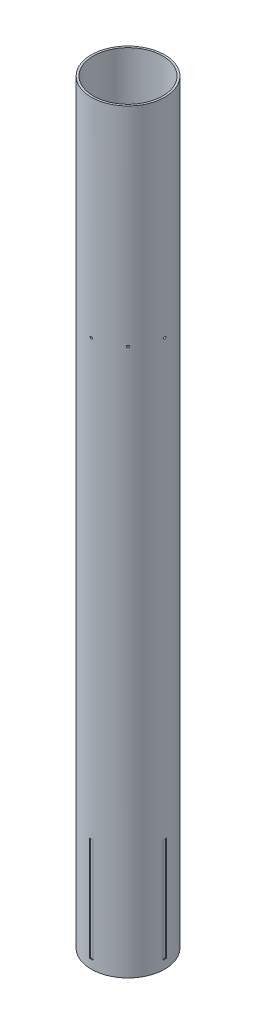
from build123d import *

# Parameters (mm, degrees)
SKETCH1_R                 = 53.721
SKETCH1_R_2               = 50.8
BODY_TUBE_EXTRUSION_DEPTH = 1104.9
BULKHEAD_HOLE_REACH       = 1113.411
SKETCH2_R                 = 1.6383
CIRPATTERN1_COUNT         = 8
SKETCH3_W                 = 5.334
SKETCH3_H                 = 152.4
CUT_EXTRUDE1_DEPTH        = 1.27
CIRPATTERN2_COUNT         = 4


with BuildPart() as part:
    # Sketch1 → Body Tube Extrusion (new body)
    with BuildSketch(Plane(origin=(0, 0, 0), x_dir=(1, 0, 0), z_dir=(0, 1, 0))):
        Circle(SKETCH1_R)
        Circle(SKETCH1_R_2, mode=Mode.SUBTRACT)
    extrude(amount=BODY_TUBE_EXTRUSION_DEPTH)

    # Sketch2 → Bulkhead Hole (cut, up to next)
    with BuildSketch(Plane.XY.offset(53.721), mode=Mode.PRIVATE) as bulkhead_hole_sk1:
        with Locations((0, 800.1)):
            Circle(SKETCH2_R)
    bulkhead_hole_tool1 = extrude(bulkhead_hole_sk1.sketch, amount=-BULKHEAD_HOLE_REACH, mode=Mode.PRIVATE) & part.part
    bulkhead_hole = bulkhead_hole_tool1.solids().sort_by_distance((0, 800.1, 53.721))[0]
    add(bulkhead_hole, mode=Mode.SUBTRACT)

    # CirPattern1: Bulkhead Hole ×8 about axis
    cirpattern1_axis = Axis((0, 1104.9, 0), (0, -1, 0))
    for i in range(1, CIRPATTERN1_COUNT):
        add(bulkhead_hole.rotate(cirpattern1_axis, i * 360 / CIRPATTERN1_COUNT), mode=Mode.SUBTRACT)

    # Sketch3 → Cut-Extrude1 (cut)
    with BuildSketch(Plane.XY.offset(53.721)):
        with Locations((0, 88.9)):
            Rectangle(SKETCH3_W, SKETCH3_H)
    cut_extrude1 = extrude(amount=-CUT_EXTRUDE1_DEPTH, mode=Mode.SUBTRACT)

    # CirPattern2: Cut-Extrude1 ×4 about axis
    cirpattern2_axis = Axis((0, 1104.9, 0), (0, -1, 0))
    for i in range(1, CIRPATTERN2_COUNT):
        add(cut_extrude1.rotate(cirpattern2_axis, i * 360 / CIRPATTERN2_COUNT), mode=Mode.SUBTRACT)


solid = part.part
